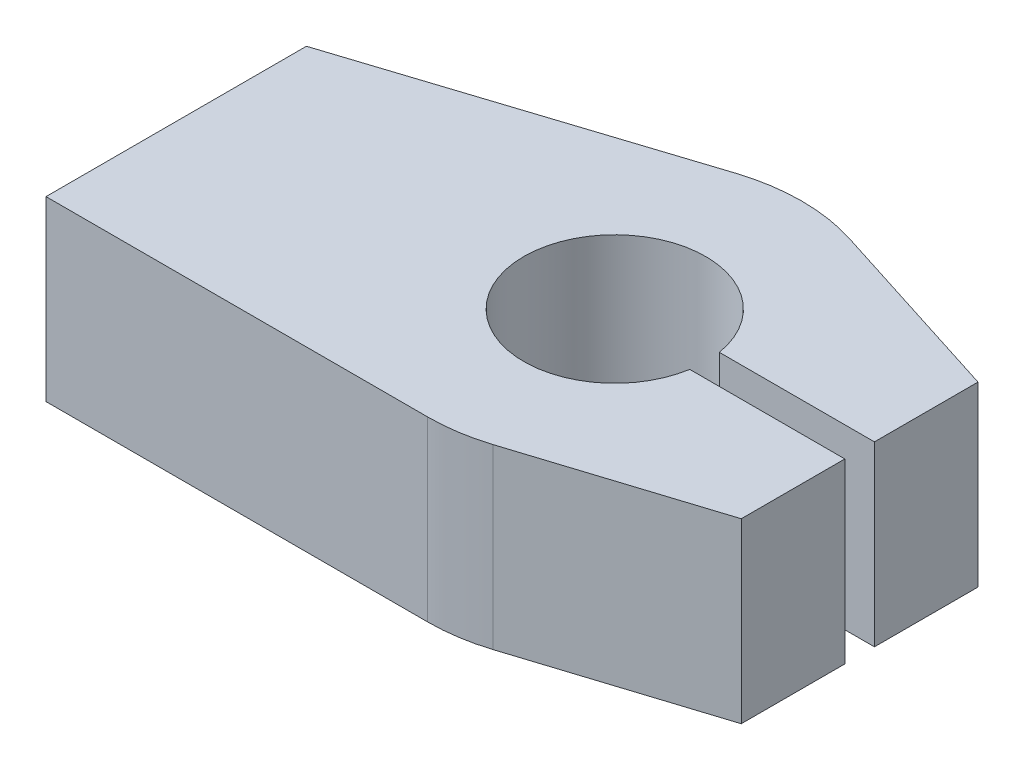
from build123d import *

# Parameters (mm, degrees)
BOSS_EXTRUDE1_DEPTH = 6


with BuildPart() as part:
    # Sketch1 → Boss-Extrude1 (new body)
    with BuildSketch(Plane(origin=(0, 0, 0), x_dir=(1, 0, 0), z_dir=(0, 1, 0))):
        with BuildLine():
            Line((-12.9, 2.48016133), (-12.9, -6.31983867))
            Line((-12.9, -6.31983867), (0, -6.31983867))
            ThreePointArc((0, -6.31983867), (0.969168266, -6.245083962), (1.915408765, -6.02258832))
            Line((1.915408765, -6.02258832), (8.275, -4))
            Line((8.275, -4), (8.275, -0.5))
            Line((8.275, -0.5), (3.03407729, -0.5))
            ThreePointArc((3.03407729, -0.5), (-3.075, 0), (3.03407729, 0.5))
            Line((3.03407729, 0.5), (8.275, 0.5))
            Line((8.275, 0.5), (8.275, 4))
            Line((8.275, 4), (1.915408765, 6.02258832))
            ThreePointArc((1.915408765, 6.02258832), (-0.0127765, 6.319825755), (-1.939744186, 6.014794536))
            Line((-1.939744186, 6.014794536), (-12.9, 2.48016133))
        make_face()
    extrude(amount=BOSS_EXTRUDE1_DEPTH)


solid = part.part
